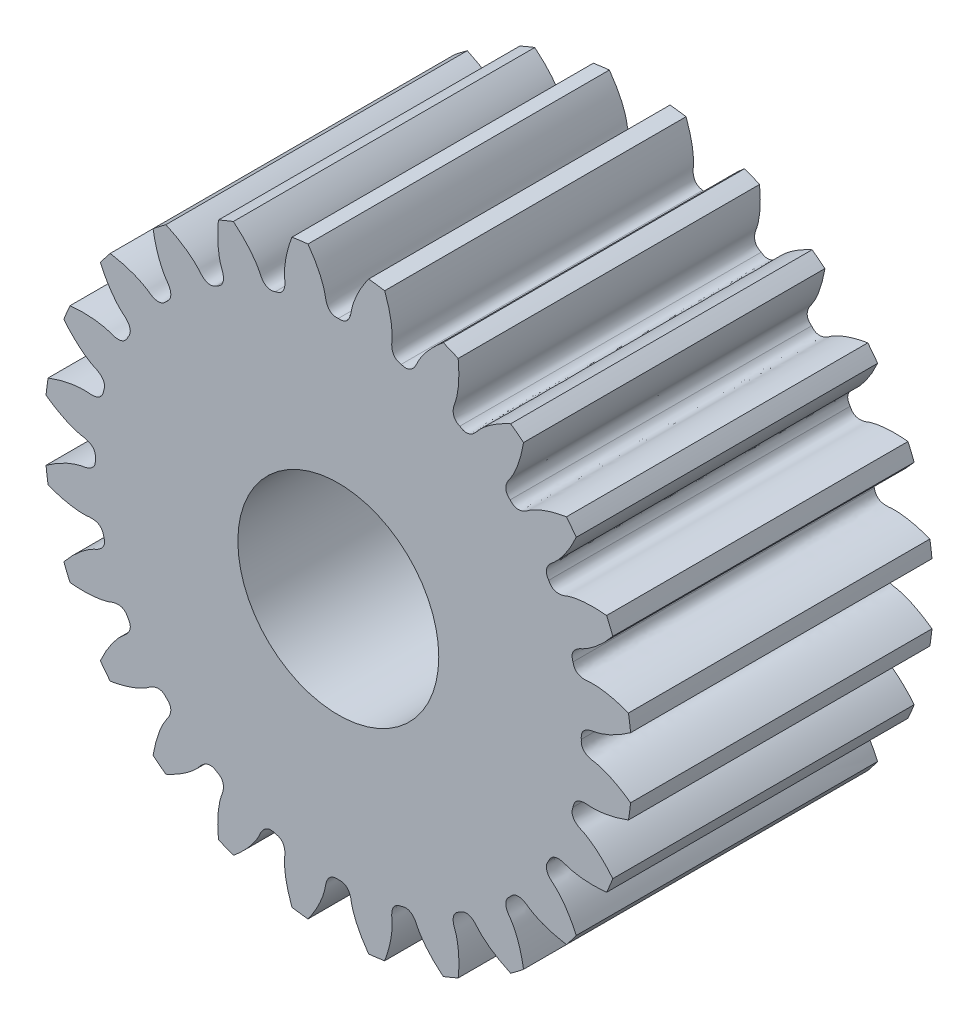
from build123d import *

# Parameters (mm, degrees)
GEAR_BASESKETCH_R                            = 5.850004606
F_0_45_MODULE_10_8000MM_P_D_DEPTH            = 3
TOOTH_CUT_COARSE_PITCH_INVOLUTE_20_DEG_DEPTH = 9.80029021
TOOTH_PATTERN_24_24_COUNT                    = 24
F_4_0_4_DIAMETER_HOLE1_D                     = 4
ECHELLE1_SCALE                               = 2
ECHELLE2_SCALE                               = 0.25


with BuildPart() as part:
    # Gear-BaseSketch → 0.45 Module, 10.8000mm P.D. (new, symmetric)
    with BuildSketch(Plane.XY):
        Circle(GEAR_BASESKETCH_R)
    extrude(amount=F_0_45_MODULE_10_8000MM_P_D_DEPTH, both=True)

    # Tooth-Sketch; Backlash: 0.0000mm → Tooth-Cut, Coarse Pitch Involute 20 deg (cut, symmetric)
    with BuildSketch(Plane.XY):
        with BuildLine():
            ThreePointArc((-0.667574706, 5.90419394), (0, 5.941814712), (0.667574706, 5.90419394))
            add(Edge.make_bspline(
                [(0.667574706, 5.90419394), (0.619703312, 5.842467664), (0.553793677, 5.750562452), (0.476832801, 5.62754325), (0.429123086, 5.543922204), (0.388691326, 5.465870206), (0.355000251, 5.393828114), (0.327490091, 5.328201964), (0.305576454, 5.269362409), (0.288665869, 5.217641826), (0.27611698, 5.173338946), (0.267361014, 5.136701882), (0.261221749, 5.106198685), (0.258001985, 5.083428932), (0.255072134, 5.066085003), (0.252582297, 5.053230307), (0.248074067, 5.032600986), (0.24051591, 5.004733527), (0.227797371, 4.970324631), (0.2113404, 4.93733852), (0.189438603, 4.905288444), (0.159221114, 4.874688382), (0.098876347, 4.83669751), (0.039088571, 4.834395224), (0, 4.837260434)],
                knots=[0, 0, 0, 0, 0.176473778, 0.255256716, 0.327737018, 0.393914687, 0.453789721, 0.50736212, 0.554631886, 0.595599017, 0.630263515, 0.658625379, 0.680684611, 0.700525381, 0.710565781, 0.720420484, 0.730102691, 0.758269098, 0.785574208, 0.812849002, 0.841358171, 0.872902425, 0.909456821, 1, 1, 1, 1], degree=3))
            add(Edge.make_bspline(
                [(-0.667574706, 5.90419394), (-0.619703312, 5.842467664), (-0.553793677, 5.750562452), (-0.476832801, 5.62754325), (-0.429123086, 5.543922204), (-0.388691326, 5.465870206), (-0.355000251, 5.393828114), (-0.327490091, 5.328201964), (-0.305576454, 5.269362409), (-0.288665869, 5.217641826), (-0.27611698, 5.173338946), (-0.267361014, 5.136701882), (-0.261221749, 5.106198685), (-0.258001985, 5.083428932), (-0.255072134, 5.066085003), (-0.252582297, 5.053230307), (-0.248074067, 5.032600986), (-0.24051591, 5.004733527), (-0.227797371, 4.970324631), (-0.2113404, 4.93733852), (-0.189438603, 4.905288444), (-0.159221114, 4.874688382), (-0.098876347, 4.83669751), (-0.039088571, 4.834395224), (0, 4.837260434)],
                knots=[0, 0, 0, 0, 0.176473778, 0.255256716, 0.327737018, 0.393914687, 0.453789721, 0.50736212, 0.554631886, 0.595599017, 0.630263515, 0.658625379, 0.680684611, 0.700525381, 0.710565781, 0.720420484, 0.730102691, 0.758269098, 0.785574208, 0.812849002, 0.841358171, 0.872902425, 0.909456821, 1, 1, 1, 1], degree=3))
        make_face()
    tooth_cut_coarse_pitch_involute_20_deg = extrude(amount=TOOTH_CUT_COARSE_PITCH_INVOLUTE_20_DEG_DEPTH, both=True, mode=Mode.SUBTRACT)

    # Tooth Pattern, 24 / 24: Tooth-Cut, Coarse Pitch Involute 20 deg ×24 about axis
    tooth_pattern_24_24_axis = Axis((0, 0, -88.99), (0, 0, 1))
    for i in range(1, TOOTH_PATTERN_24_24_COUNT):
        add(tooth_cut_coarse_pitch_involute_20_deg.rotate(tooth_pattern_24_24_axis, i * 360 / TOOTH_PATTERN_24_24_COUNT), mode=Mode.SUBTRACT)

    # Ø4.0 (4) Diameter Hole1 (through all)
    with Locations(Plane.XY.offset(3)):
        with Locations((0, 0)):
            Hole(F_4_0_4_DIAMETER_HOLE1_D / 2)


with BuildPart() as part_1:
    # Echelle1: scaled about (3.199e-06, 0, 0)
    add(part.part.scale(ECHELLE1_SCALE).moved(Location((-3.199e-06, 0, 0))))


with BuildPart() as part_2:
    # Echelle2: scaled about (3.199e-06, 0, 0)
    add(part_1.part.scale(ECHELLE2_SCALE).moved(Location((2.399e-06, 0, 0))))


solid = part_2.part
